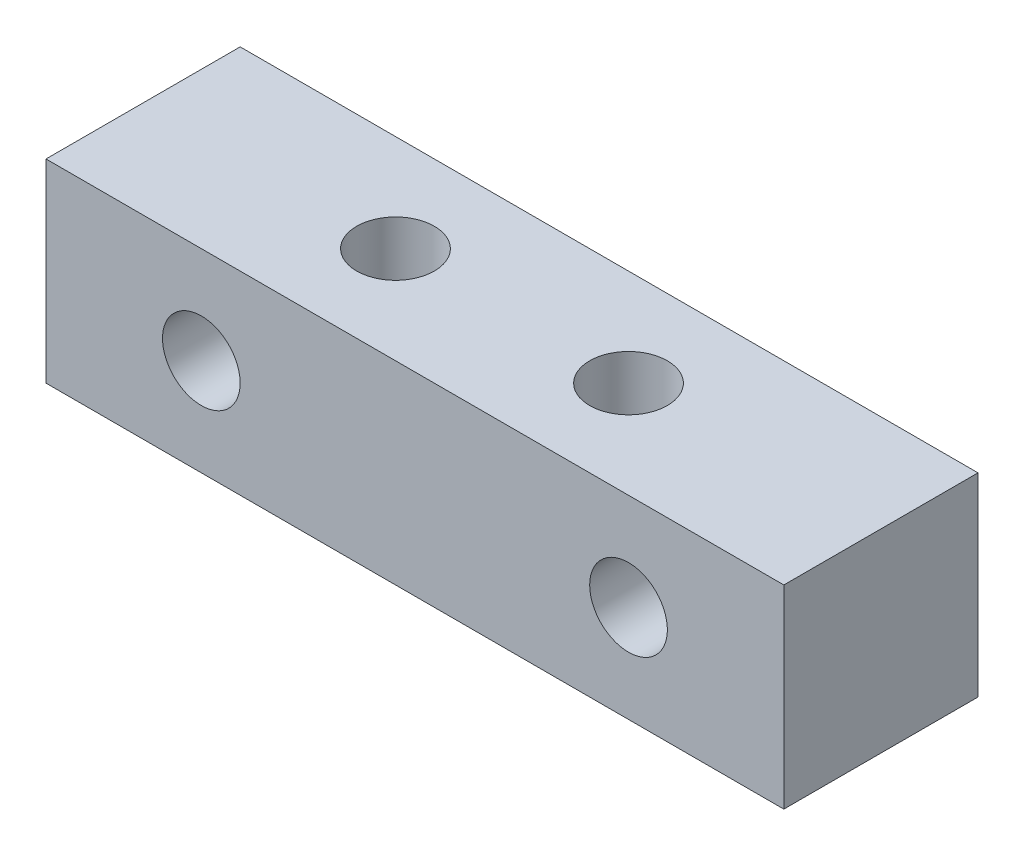
from build123d import *

# Parameters (mm, degrees)
SKETCH_1_W          = 38
SKETCH_1_H          = 10
EXTRUDE_1_DEPTH     = 10
SKETCH_3_R          = 2
CUT_EXTRUDE_1_DEPTH = 10
SKETCH_4_R          = 2
CUT_EXTRUDE_2_DEPTH = 10


with BuildPart() as part:
    # 草图1 → 凸台-拉伸1 (new body)
    with BuildSketch(Plane.XY):
        Rectangle(SKETCH_1_W, SKETCH_1_H)
    extrude(amount=EXTRUDE_1_DEPTH)

    # 草图3 → 切除-拉伸1 (cut)
    with BuildSketch(Plane.XY.offset(10)):
        with Locations((-11, 0)):
            Circle(SKETCH_3_R)
        with Locations((11, 0)):
            Circle(SKETCH_3_R)
    extrude(amount=-CUT_EXTRUDE_1_DEPTH, mode=Mode.SUBTRACT)

    # 草图4 → 切除-拉伸2 (cut)
    with BuildSketch(Plane(origin=(0, 5, 0), x_dir=(1, 0, 0), z_dir=(0, 1, 0))):
        with Locations((-6, -5)):
            Circle(SKETCH_4_R)
        with Locations((6, -5)):
            Circle(SKETCH_4_R)
    extrude(amount=-CUT_EXTRUDE_2_DEPTH, mode=Mode.SUBTRACT)


solid = part.part
